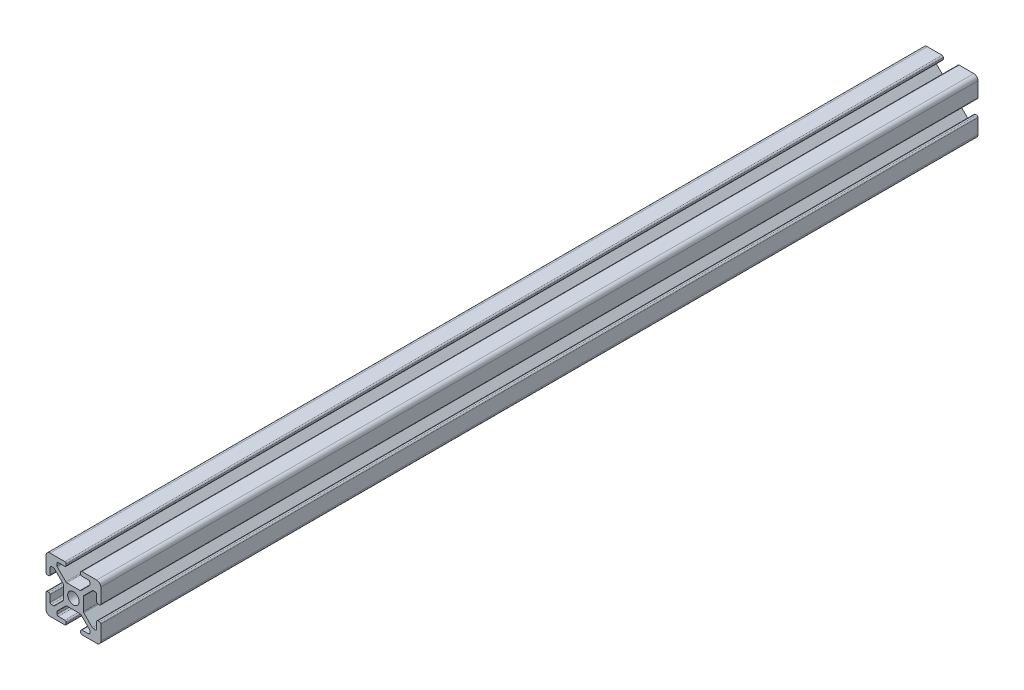
from build123d import *

# Parameters (mm, degrees)
SKETCH1_W           = 20
SKETCH1_H           = 20
BOSS_EXTRUDE1_DEPTH = 320
CUT_EXTRUDE1_DEPTH  = 321.312347561
FILLET1_R           = 0.5
CIRPATTERN1_START   = -320
CIRPATTERN1_DEPTH   = 320
FILLET2_R           = 1.5
SKETCH3_R           = 2.095
CUT_EXTRUDE2_DEPTH  = 321.312347561
FILLET3_R           = 0.5


# Read off the part's stored shape, not the designer's step: CirPattern1
with BuildPart() as part:
    # Sketch1 → Boss-Extrude1 (new body)
    with BuildSketch(Plane.XY):
        Rectangle(SKETCH1_W, SKETCH1_H)
    extrude(amount=-BOSS_EXTRUDE1_DEPTH)

    # Sketch2 → Cut-Extrude1 (cut, through all)
    with BuildSketch(Plane.XY):
        Polygon((0, 10), (-2.63, 10), (-2.63, 8.5), (-5.995, 8.5), (-5.995, 7.055660172), (-2.594339828, 3.655), (2.594339828, 3.655), (5.995, 7.055660172), (5.995, 8.5), (2.63, 8.5), (2.63, 10), align=None)
    extrude(amount=-CUT_EXTRUDE1_DEPTH, mode=Mode.SUBTRACT)

    # Fillet1
    fillet1_edges = [part.edges().sort_by_distance(p)[0] for p in [
        (2.63, 10, -160),
        (2.63, 8.5, -160),
        (5.995, 8.5, -160),
        (5.995, 7.055660172, -160),
        (2.594339828, 3.655, -160),
        (-2.594339828, 3.655, -160),
        (-5.995, 7.055660172, -160),
        (-5.995, 8.5, -160),
        (-2.63, 8.5, -160),
        (-2.63, 10, -160),
    ]]
    fillet(fillet1_edges, radius=FILLET1_R)

    # CirPattern1 outline → CirPattern1 (cut)
    with BuildSketch(Plane.XY.offset(CIRPATTERN1_START)):
        with BuildLine():
            Line((-2.63, -10), (2.63, -10))
            Line((2.63, -10), (2.63, -9))
            ThreePointArc((2.63, -9), (2.776446609, -8.646446609), (3.13, -8.5))
            Line((3.13, -8.5), (5.495, -8.5))
            ThreePointArc((5.495, -8.5), (5.848553391, -8.353553391), (5.995, -8))
            Line((5.995, -8), (5.995, -7.262766953))
            ThreePointArc((5.995, -7.262766953), (5.956939766, -7.071425237), (5.848553391, -6.909213562))
            Line((5.848553391, -6.909213562), (2.740786438, -3.801446609))
            ThreePointArc((2.740786438, -3.801446609), (2.578574763, -3.693060234), (2.387233047, -3.655))
            Line((2.387233047, -3.655), (-2.387233047, -3.655))
            ThreePointArc((-2.387233047, -3.655), (-2.578574763, -3.693060234), (-2.740786438, -3.801446609))
            Line((-2.740786438, -3.801446609), (-5.848553391, -6.909213562))
            ThreePointArc((-5.848553391, -6.909213562), (-5.956939766, -7.071425237), (-5.995, -7.262766953))
            Line((-5.995, -7.262766953), (-5.995, -8))
            ThreePointArc((-5.995, -8), (-5.848553391, -8.353553391), (-5.495, -8.5))
            Line((-5.495, -8.5), (-3.13, -8.5))
            ThreePointArc((-3.13, -8.5), (-2.776446609, -8.646446609), (-2.63, -9))
            Line((-2.63, -9), (-2.63, -10))
        make_face()
        with BuildLine():
            Line((-10, 2.63), (-10, -2.63))
            Line((-10, -2.63), (-9, -2.63))
            ThreePointArc((-9, -2.63), (-8.646446609, -2.776446609), (-8.5, -3.13))
            Line((-8.5, -3.13), (-8.5, -5.495))
            ThreePointArc((-8.5, -5.495), (-8.353553391, -5.848553391), (-8, -5.995))
            Line((-8, -5.995), (-7.262766953, -5.995))
            ThreePointArc((-7.262766953, -5.995), (-7.071425237, -5.956939766), (-6.909213562, -5.848553391))
            Line((-6.909213562, -5.848553391), (-3.801446609, -2.740786438))
            ThreePointArc((-3.801446609, -2.740786438), (-3.693060234, -2.578574763), (-3.655, -2.387233047))
            Line((-3.655, -2.387233047), (-3.655, 2.387233047))
            ThreePointArc((-3.655, 2.387233047), (-3.693060234, 2.578574763), (-3.801446609, 2.740786438))
            Line((-3.801446609, 2.740786438), (-6.909213562, 5.848553391))
            ThreePointArc((-6.909213562, 5.848553391), (-7.071425237, 5.956939766), (-7.262766953, 5.995))
            Line((-7.262766953, 5.995), (-8, 5.995))
            ThreePointArc((-8, 5.995), (-8.353553391, 5.848553391), (-8.5, 5.495))
            Line((-8.5, 5.495), (-8.5, 3.13))
            ThreePointArc((-8.5, 3.13), (-8.646446609, 2.776446609), (-9, 2.63))
            Line((-9, 2.63), (-10, 2.63))
        make_face()
        with BuildLine():
            Line((9, -2.63), (10, -2.63))
            Line((10, -2.63), (10, 2.63))
            Line((10, 2.63), (9, 2.63))
            ThreePointArc((9, 2.63), (8.646446609, 2.776446609), (8.5, 3.13))
            Line((8.5, 3.13), (8.5, 5.495))
            ThreePointArc((8.5, 5.495), (8.353553391, 5.848553391), (8, 5.995))
            Line((8, 5.995), (7.262766953, 5.995))
            ThreePointArc((7.262766953, 5.995), (7.071425237, 5.956939766), (6.909213562, 5.848553391))
            Line((6.909213562, 5.848553391), (3.801446609, 2.740786438))
            ThreePointArc((3.801446609, 2.740786438), (3.693060234, 2.578574763), (3.655, 2.387233047))
            Line((3.655, 2.387233047), (3.655, -2.387233047))
            ThreePointArc((3.655, -2.387233047), (3.693060234, -2.578574763), (3.801446609, -2.740786438))
            Line((3.801446609, -2.740786438), (6.909213562, -5.848553391))
            ThreePointArc((6.909213562, -5.848553391), (7.071425237, -5.956939766), (7.262766953, -5.995))
            Line((7.262766953, -5.995), (8, -5.995))
            ThreePointArc((8, -5.995), (8.353553391, -5.848553391), (8.5, -5.495))
            Line((8.5, -5.495), (8.5, -3.13))
            ThreePointArc((8.5, -3.13), (8.646446609, -2.776446609), (9, -2.63))
        make_face()
    extrude(amount=CIRPATTERN1_DEPTH, mode=Mode.SUBTRACT)

    # Fillet2
    fillet2_edges = [part.edges().sort_by_distance(p)[0] for p in [
        (10, -10, -160),
        (-10, -10, -160),
        (-10, 10, -160),
        (10, 10, -160),
    ]]
    fillet(fillet2_edges, radius=FILLET2_R)

    # Sketch3 → Cut-Extrude2 (cut, through all)
    with BuildSketch(Plane.XY):
        Circle(SKETCH3_R)
    extrude(amount=-CUT_EXTRUDE2_DEPTH, mode=Mode.SUBTRACT)

    # Fillet3
    fillet3_edges = [part.edges().sort_by_distance(p)[0] for p in [
        (-10, 2.63, -160),
        (-10, -2.63, -160),
        (-2.63, -10, -160),
        (2.63, -10, -160),
        (10, -2.63, -160),
        (10, 2.63, -160),
    ]]
    fillet(fillet3_edges, radius=FILLET3_R)


solid = part.part
